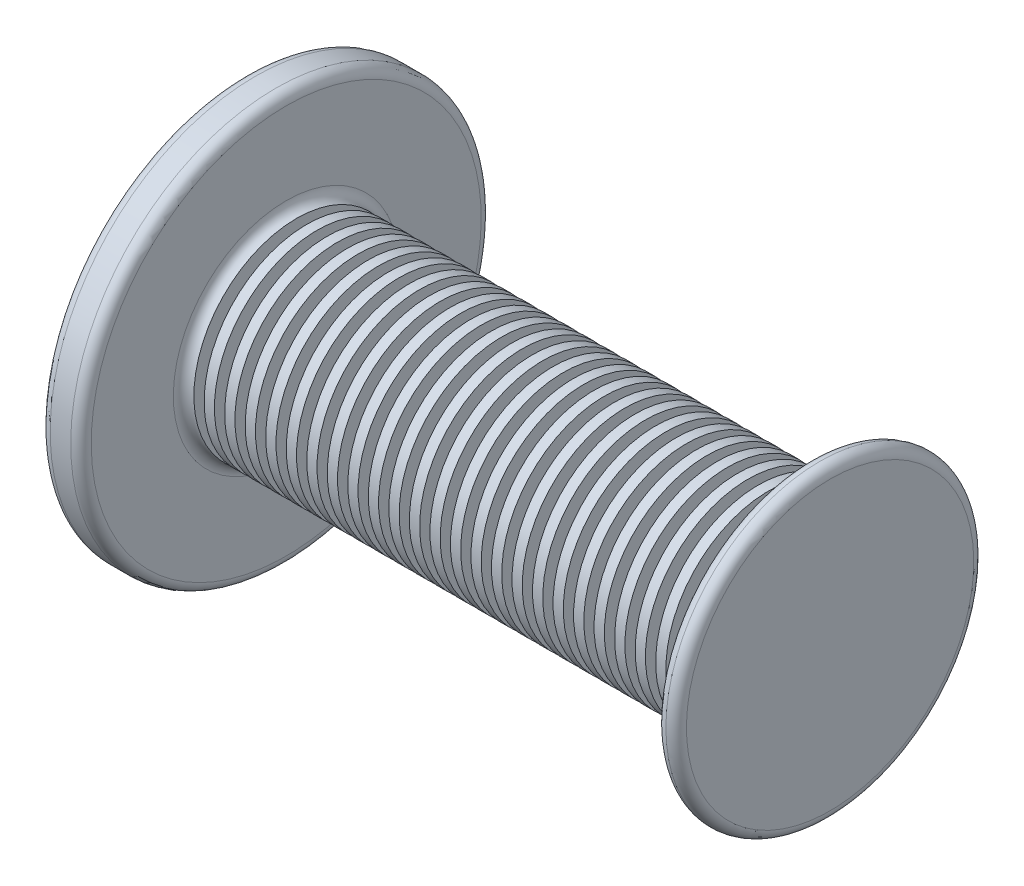
from build123d import *

# Parameters (mm, degrees)
FILLET1_R           = 1
FILLET2_R           = 1
FILLET3_R           = 1
CUT_EXTRUDE12_START = 1
SKETCH3_R           = 10
SKETCH3_R_2         = 7.5
CUT_EXTRUDE12_DEPTH = 1
LPATTERN1_COUNT     = 25
LPATTERN1_PITCH     = 2
SKETCH5_R           = 5
CUT_EXTRUDE13_DEPTH = 55


with BuildPart() as part:
    # Sketch1 → Revolve2 (revolve)
    with BuildSketch(Plane.XY):
        Polygon((0, 0), (0, 20), (4, 20), (4, 10), (55, 10), (55, 15), (57, 15), (57, 0), align=None)
    revolve(axis=Axis((57, 0, 0), (-1, 0, 0)))

    # Fillet1
    fillet1_edges = [part.edges().sort_by_distance(p)[0] for p in [
        (57, -15, 0),
        (55, -15, 0),
    ]]
    fillet(fillet1_edges, radius=FILLET1_R - 0.0001)  # a hair under: the kernel refuses the full size

    # Fillet2
    fillet2_edges = [part.edges().sort_by_distance(p)[0] for p in [
        (4, -20, 0),
        (0, -20, 0),
    ]]
    fillet(fillet2_edges, radius=FILLET2_R)

    # Fillet3
    fillet3_edges = [part.edges().sort_by_distance(p)[0] for p in [
        (55, -10, 0),
        (4, -10, 0),
    ]]
    fillet(fillet3_edges, radius=FILLET3_R)

    # Sketch3 → Cut-Extrude12 (cut)
    with BuildSketch(Plane(origin=(5, 0, 0), x_dir=(0, 0, -1), z_dir=(1, 0, 0)).offset(CUT_EXTRUDE12_START)):
        Circle(SKETCH3_R)
        Circle(SKETCH3_R_2, mode=Mode.SUBTRACT)
    cut_extrude12 = extrude(amount=-CUT_EXTRUDE12_DEPTH, mode=Mode.SUBTRACT)

    # LPattern1: Cut-Extrude12 ×25
    with Locations(*[(i * LPATTERN1_PITCH, 0, 0) for i in range(1, LPATTERN1_COUNT)]):
        add(cut_extrude12, mode=Mode.SUBTRACT)

    # Sketch5 → Cut-Extrude13 (cut)
    with BuildSketch(Plane.ZY):
        with Locations(Location((0, 0, 0), (0, 0, 270))):
            Circle(SKETCH5_R)
    extrude(amount=-CUT_EXTRUDE13_DEPTH, mode=Mode.SUBTRACT)


solid = part.part
